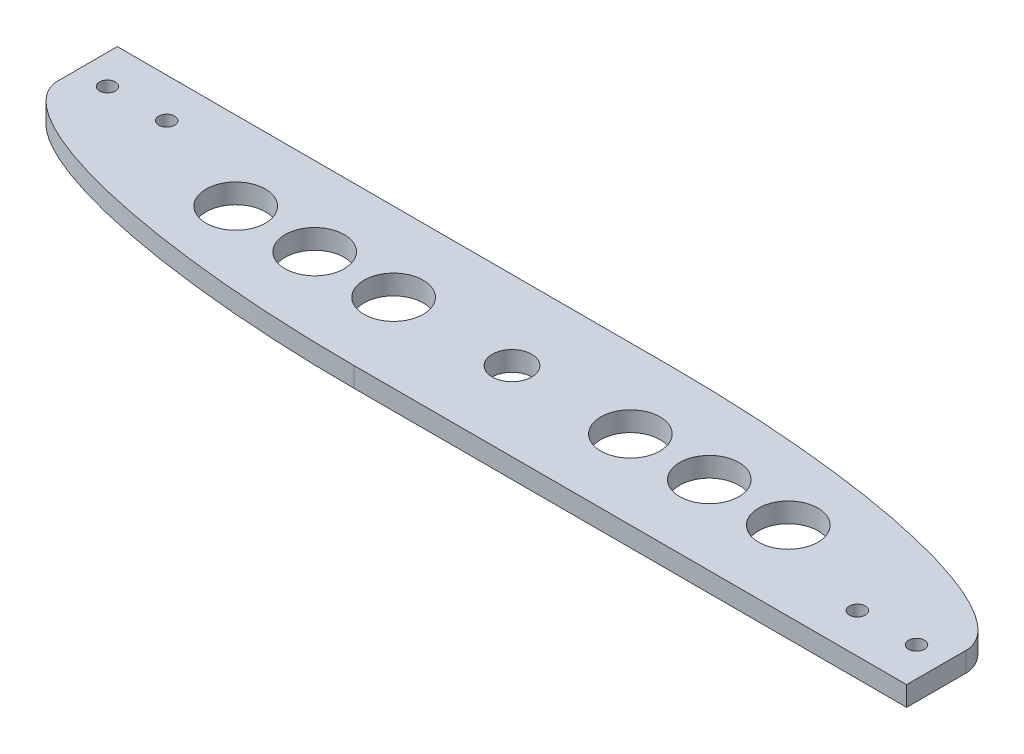
from build123d import *

# Parameters (mm, degrees)
SKETCH2_W           = 304.8
SKETCH2_H           = 50.8
SKETCH2_R           = 6.35
SKETCH2_R_2         = 9.525
SKETCH2_R_3         = 2.5527
BOSS_EXTRUDE2_DEPTH = 3.175
FILLET1_SIZE        = 127
FILLET1_SIZE_2      = 31.75


with BuildPart() as part:
    # Sketch2 → Boss-Extrude2 (new, symmetric)
    with BuildSketch(Plane(origin=(0, 0, 0), x_dir=(1, 0, 0), z_dir=(0, 1, 0))):
        Rectangle(SKETCH2_W, SKETCH2_H)
        with Locations(Location((0, 0, 0), (0, 0, 270))):
            Circle(SKETCH2_R, mode=Mode.SUBTRACT)
        with Locations(Location((-38.1, 0, 0), (0, 0, 270))):
            Circle(SKETCH2_R_2, mode=Mode.SUBTRACT)
        with Locations(Location((-63.5, 0, 0), (0, 0, 270))):
            Circle(SKETCH2_R_2, mode=Mode.SUBTRACT)
        with Locations(Location((-88.9, 0, 0), (0, 0, 270))):
            Circle(SKETCH2_R_2, mode=Mode.SUBTRACT)
        with Locations(Location((38.1, 0, 0), (0, 0, 90))):
            Circle(SKETCH2_R_2, mode=Mode.SUBTRACT)
        with Locations(Location((63.5, 0, 0), (0, 0, 90))):
            Circle(SKETCH2_R_2, mode=Mode.SUBTRACT)
        with Locations(Location((88.9, 0, 0), (0, 0, 90))):
            Circle(SKETCH2_R_2, mode=Mode.SUBTRACT)
        with Locations(Location((142.875, -12.7, 0), (0, 0, 270))):
            Circle(SKETCH2_R_3, mode=Mode.SUBTRACT)
        with Locations(Location((123.825, -12.7, 0), (0, 0, 270))):
            Circle(SKETCH2_R_3, mode=Mode.SUBTRACT)
        with Locations(Location((-142.875, 12.7, 0), (0, 0, 270))):
            Circle(SKETCH2_R_3, mode=Mode.SUBTRACT)
        with Locations(Location((-123.825, 12.7, 0), (0, 0, 270))):
            Circle(SKETCH2_R_3, mode=Mode.SUBTRACT)
    extrude(amount=BOSS_EXTRUDE2_DEPTH, both=True)

    # Fillet1
    # an asymmetric fillet: 127, 31.75 mm, written as the material it takes off along each edge
    with BuildSketch(Plane(origin=(152.4, -320.675, -25.4), x_dir=(-1, 0, 0), z_dir=(0, 1, 0))) as fillet1_piece_1:
        with BuildLine():
            Bezier((FILLET1_SIZE, 0), (0, 0), (0, FILLET1_SIZE_2), weights=[1, 0.707106781, 1])
            Line((0, FILLET1_SIZE_2), (0, 0))
            Line((0, 0), (FILLET1_SIZE, 0))
        make_face()
    extrude(amount=641.35, mode=Mode.SUBTRACT)
    with BuildSketch(Plane(origin=(-152.4, 320.675, 25.4), x_dir=(1, 0, 0), z_dir=(0, -1, 0))) as fillet1_piece_2:
        with BuildLine():
            Bezier((FILLET1_SIZE, 0), (0, 0), (0, -FILLET1_SIZE_2), weights=[1, 0.707106781, 1])
            Line((0, -FILLET1_SIZE_2), (0, 0))
            Line((0, 0), (FILLET1_SIZE, 0))
        make_face()
    extrude(amount=641.35, mode=Mode.SUBTRACT)


solid = part.part
